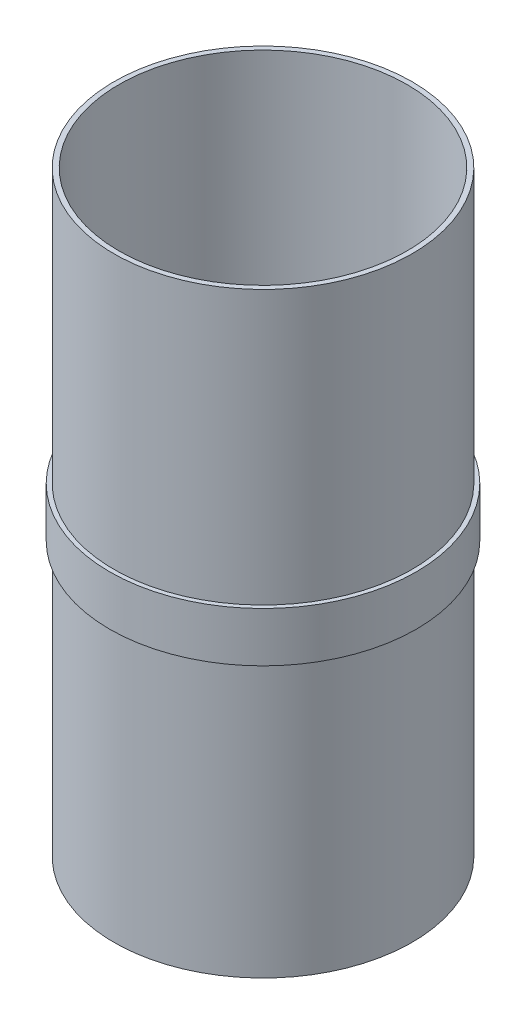
from build123d import *

# Parameters (mm, degrees)
SKETCH1_R           = 78.359
SKETCH1_R_2         = 76.2
BOSS_EXTRUDE1_DEPTH = 12.7
SKETCH2_R           = 76.2
SKETCH2_R_2         = 73.66
BOSS_EXTRUDE2_DEPTH = 152.4


with BuildPart() as part:
    # Sketch1 → Boss-Extrude1 (new, symmetric)
    with BuildSketch(Plane(origin=(0, 0, 0), x_dir=(1, 0, 0), z_dir=(0, 1, 0))):
        Circle(SKETCH1_R)
        Circle(SKETCH1_R_2, mode=Mode.SUBTRACT)
    extrude(amount=BOSS_EXTRUDE1_DEPTH, both=True)

    # Sketch2 → Boss-Extrude2 (add, symmetric)
    with BuildSketch(Plane(origin=(0, 0, 0), x_dir=(1, 0, 0), z_dir=(0, 1, 0))):
        Circle(SKETCH2_R)
        Circle(SKETCH2_R_2, mode=Mode.SUBTRACT)
    extrude(amount=BOSS_EXTRUDE2_DEPTH, both=True)


solid = part.part
